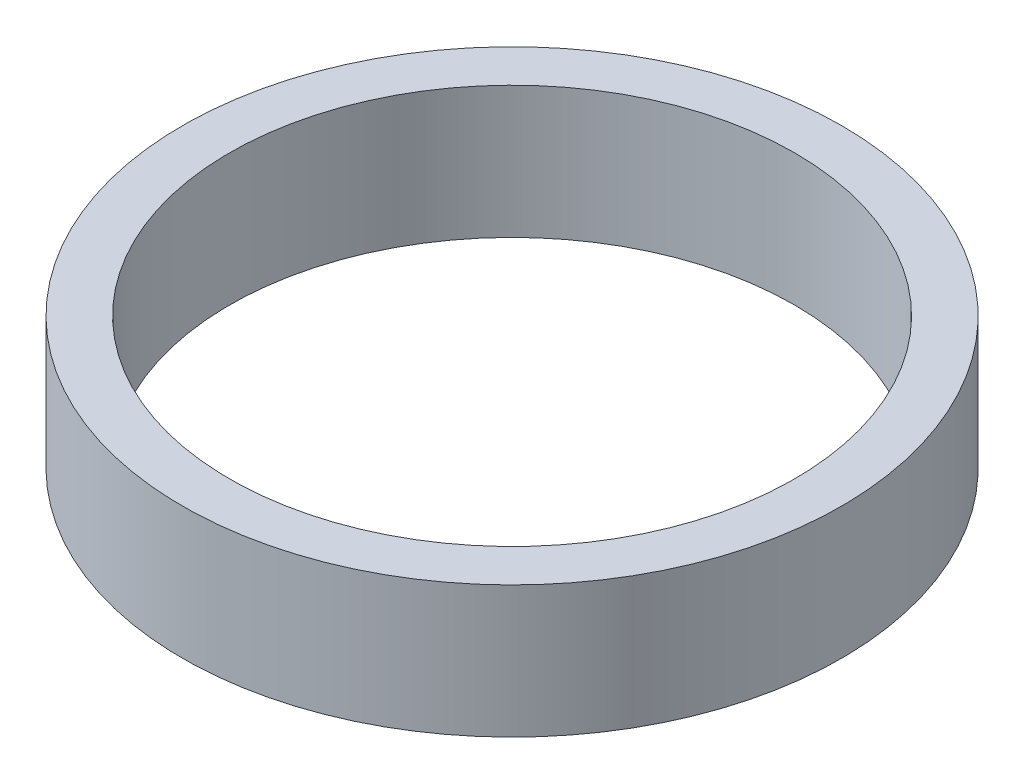
from build123d import *

# Parameters (mm, degrees)
SKETCH1_R           = 52.5
BOSS_EXTRUDE1_DEPTH = 21
SKETCH2_R           = 45
CUT_EXTRUDE1_DEPTH  = 78.158926898


with BuildPart() as part:
    # Sketch1 → Boss-Extrude1 (new body)
    with BuildSketch(Plane(origin=(0, 0, 0), x_dir=(1, 0, 0), z_dir=(0, 1, 0))):
        Circle(SKETCH1_R)
    extrude(amount=BOSS_EXTRUDE1_DEPTH)

    # Sketch2 → Cut-Extrude1 (cut, through all)
    with BuildSketch(Plane(origin=(0, 0, 0), x_dir=(1, 0, 0), z_dir=(0, 1, 0))):
        Circle(SKETCH2_R)
    extrude(amount=CUT_EXTRUDE1_DEPTH, mode=Mode.SUBTRACT)


solid = part.part
